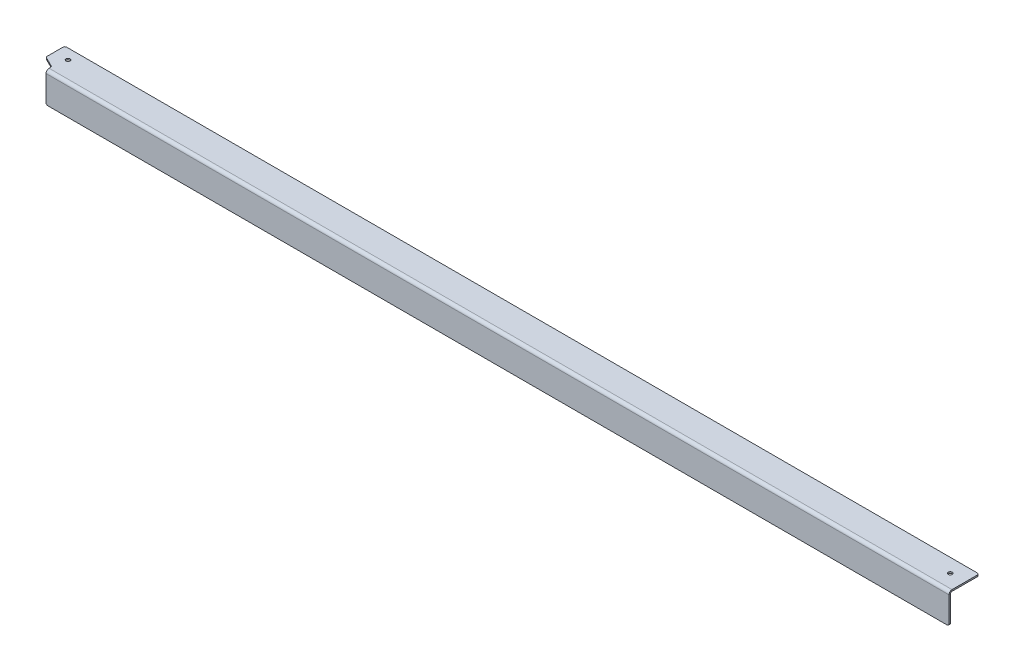
from build123d import *

# Parameters (mm, degrees)
BASE_FLANGE1_DEPTH               = 2.5908
EDGE_FLANGE1_STRIP_W             = 15.4432
EDGE_FLANGE1_STRIP_H             = 2.5908
EDGE_FLANGE1_STRIP_CUT_DEPTH     = 1524
EDGE_FLANGE1_DEPTH               = 1524
F_17_64_0_26563_DIAMETER_HOLE1_D = 6.747002
FILLET1_R                        = 3.175
F_17_64_0_26563_DIAMETER_HOLE2_D = 6.747002


# Sheet-metal steps are written as plain solids
with BuildPart() as part:
    # Sketch2 → Base-Flange1 (new body)
    with BuildSketch(Plane(origin=(0, 0, 0), x_dir=(1, 0, 0), z_dir=(0, 1, 0))):
        Polygon((0, 0), (1524, 0), (1524, 50.8), (-19.05, 50.8), (-19.05, 19.05), (0, 9.525), align=None)
    extrude(amount=-BASE_FLANGE1_DEPTH)

    # Edge-Flange1 strip (across the edge) → Edge-Flange1 strip cut (cut)
    with BuildSketch(Plane(origin=(1524, -2.5908, 0), x_dir=(0, 0, -1), z_dir=(-1, 0, 0))):
        with Locations((-2.5908, -1.2954)):
            Rectangle(EDGE_FLANGE1_STRIP_W, EDGE_FLANGE1_STRIP_H)
    extrude(amount=EDGE_FLANGE1_STRIP_CUT_DEPTH, mode=Mode.SUBTRACT)

    # Edge-Flange1 section (across the edge) → Edge-Flange1 (add)
    with BuildSketch(Plane(origin=(1524, -2.5908, 0), x_dir=(0, 0, -1), z_dir=(-1, 0, 0))):
        with BuildLine():
            Line((0, 2.54), (0, 48.2092))
            Line((0, 48.2092), (2.5908, 48.2092))
            Line((2.5908, 48.2092), (2.5908, 2.54))
            ThreePointArc((2.5908, 2.54), (3.334748776, 0.743948776), (5.1308, 0))
            Line((5.1308, 0), (5.1308, -2.5908))
            ThreePointArc((5.1308, -2.5908), (1.502776527, -1.088023473), (0, 2.54))
        make_face()
    extrude(amount=EDGE_FLANGE1_DEPTH)

    # 17/64 (0.26563) Diameter Hole1 (through all)
    with Locations(Plane(origin=(0, 0, 0), x_dir=(1, 0, 0), z_dir=(0, 1, 0))):
        with Locations((1498.6, 27.305)):
            Hole(F_17_64_0_26563_DIAMETER_HOLE1_D / 2)

    # Fillet1
    fillet1_edges = [part.edges().sort_by_distance(p)[0] for p in [
        (0, -1.2954, -9.525),
        (-19.05, -1.2954, -19.05),
        (-19.05, -1.2954, -50.8),
        (1524, -1.2954, -50.8),
        (1524, -50.8, -1.2954),
        (0, -50.8, -1.2954),
    ]]
    fillet(fillet1_edges, radius=FILLET1_R)

    # 17/64 (0.26563) Diameter Hole2 (through all)
    with Locations(Plane(origin=(0, 0, 0), x_dir=(1, 0, 0), z_dir=(0, 1, 0))):
        with Locations((3.81, 33.3375)):
            Hole(F_17_64_0_26563_DIAMETER_HOLE2_D / 2)


solid = part.part
